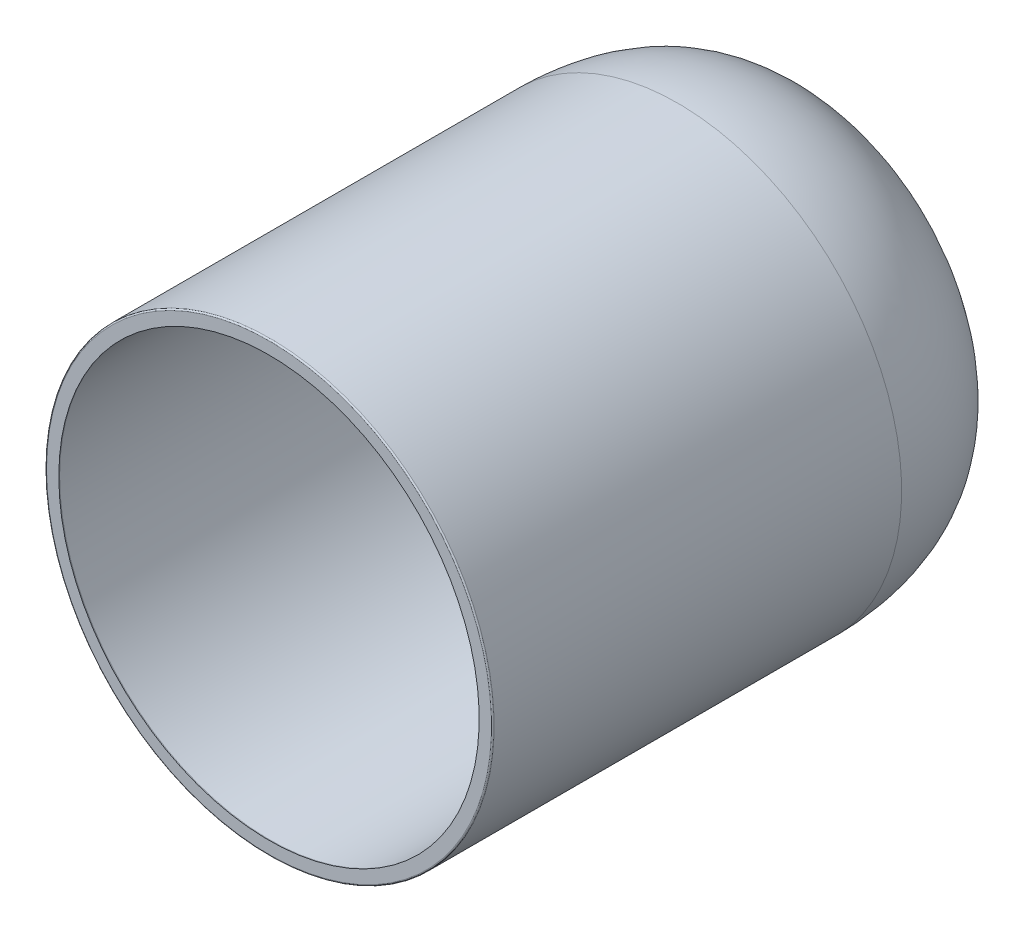
from build123d import *

# Parameters (mm, degrees)
REVOLVE_THIN3_OUTLINE_W   = 2.54
REVOLVE_THIN3_OUTLINE_H   = 76.976451611
REVOLVE_THIN3_OUTLINE_H_2 = 0.206366599
REVOLVE_THIN3_OUTLINE_H_3 = 0.02094686
SKETCH32_R                = 47.246273806
SKETCH32_R_2              = 1.041920848
BOSS_EXTRUDE1_DEPTH       = 2.54
FILLET1_R                 = 2.54
SKETCH33_W                = 85.158841119
SKETCH33_H                = 0.170915888
CUT_EXTRUDE1_DEPTH        = 108.458
FILLET2_R                 = 0.254
FILLET3_R                 = 0.254
SCALE3_SCALE              = 1.65
SKETCH35_W                = 53.780187303
SKETCH35_H                = 190.112658653
CUT_EXTRUDE2_DEPTH        = 201.422


# Read off the part's stored shape, not the designer's step: Revolve-Thin3
with BuildPart() as part:
    # Revolve-Thin3 outline → Revolve-Thin3 (revolve)
    with BuildSketch(Plane.XZ.offset(-16.473592108)):
        with Locations((40.968314643, -5.968874658)):
            Rectangle(REVOLVE_THIN3_OUTLINE_W, REVOLVE_THIN3_OUTLINE_H)
        with BuildLine():
            add(Edge.make_bspline(
                [(39.698314643, 32.519351147), (39.687726817, 32.588202211), (39.677799336, 32.656993484), (39.668523832, 32.725717746)],
                knots=[0, 0, 0, 0, 0.007277117, 0.007277117, 0.007277117, 0.007277117], degree=3))
            Line((39.698314643, 32.519351147), (39.698314643, 32.725717746))
            Line((39.698314643, 32.725717746), (39.668523832, 32.725717746))
        make_face()
        with Locations((40.968314643, 32.622534446)):
            Rectangle(REVOLVE_THIN3_OUTLINE_W, REVOLVE_THIN3_OUTLINE_H_2)
        with BuildLine():
            add(Edge.make_bspline(
                [(39.668523832, 32.725717746), (39.518472779, 33.837479263), (39.539043978, 34.931703978), (39.695973098, 35.985611225), (39.697140195, 35.99339708), (39.698314643, 36.001180261)],
                knots=[0.007277117, 0.007277117, 0.007277117, 0.007277117, 0.125, 0.125, 0.125876466, 0.125876466, 0.125876466, 0.125876466], degree=3))
            Line((39.668523832, 32.725717746), (39.698314643, 32.725717746))
            Line((39.698314643, 32.725717746), (39.698314643, 36.001180261))
        make_face()
        with BuildLine():
            Line((39.698314643, -44.478047324), (39.698314643, -44.457100464))
            add(Edge.make_bspline(
                [(39.697961573, -44.478047324), (39.698080508, -44.471066539), (39.698198198, -44.464084253), (39.698314643, -44.457100464)],
                knots=[0.999591782, 0.999591782, 0.999591782, 0.999591782, 1, 1, 1, 1], degree=3))
            Line((39.697961573, -44.478047324), (39.698314643, -44.478047324))
        make_face()
        with Locations((40.968314643, -44.467573894)):
            Rectangle(REVOLVE_THIN3_OUTLINE_W, REVOLVE_THIN3_OUTLINE_H_3)
        with BuildLine():
            Line((39.698314643, 36.001180261), (39.698314643, 32.725717746))
            Line((39.698314643, 32.725717746), (42.238314643, 32.725717746))
            add(Edge.make_bspline(
                [(42.238314643, 32.725717746), (42.054562539, 33.777592883), (42.068967464, 34.803136992), (42.238314643, 35.799403945)],
                knots=[0, 0, 0, 0, 0.141281123, 0.141281123, 0.141281123, 0.141281123], degree=3))
            Line((42.238314643, 35.799403945), (42.238314643, 42.203297665))
            add(Edge.make_bspline(
                [(39.698314643, 36.001180261), (39.864637797, 37.10341997), (40.178381679, 38.152034474), (41.000947274, 40.135916369), (41.510862605, 41.071843995), (42.130351801, 42.038577334), (42.184085036, 42.121152876), (42.238314643, 42.203297665)],
                knots=[0.125876466, 0.125876466, 0.125876466, 0.125876466, 0.25, 0.25, 0.375, 0.375, 0.386733849, 0.386733849, 0.386733849, 0.386733849], degree=3))
        make_face()
        with BuildLine():
            Line((39.698314643, -44.478047324), (39.697961573, -44.478047324))
            add(Edge.make_bspline(
                [(18.010435206, -70.677083721), (19.79573085, -70.522158772), (21.456515081, -70.25595625), (24.590707244, -69.498066317), (26.054293619, -68.998406284), (28.729976787, -67.78317439), (29.942341958, -67.068017905), (32.141805888, -65.420707287), (33.129574164, -64.488411909), (34.902639951, -62.386085615), (35.688102783, -61.215394241), (37.05999238, -58.60954034), (37.646016791, -57.174096931), (39.087083849, -52.452836699), (39.625242566, -48.746219412), (39.697961573, -44.478047324)],
                knots=[0.004627238, 0.004627238, 0.004627238, 0.004627238, 0.125, 0.125, 0.25, 0.25, 0.375, 0.375, 0.5, 0.5, 0.625, 0.625, 0.75, 0.75, 0.999591782, 0.999591782, 0.999591782, 0.999591782], degree=3))
            Line((18.010435206, -70.677083721), (18.010435206, -70.694456457))
            Line((18.010435206, -70.694456457), (28.462249201, -70.694456457))
            add(Edge.make_bspline(
                [(28.462249201, -70.694456457), (36.319875776, -67.117155429), (39.698314643, -58.770046926)],
                knots=[0.250450742, 0.250450742, 0.250450742, 0.688405646, 0.688405646, 0.688405646], degree=2))
            Line((39.698314643, -58.770046926), (39.698314643, -44.478047324))
        make_face()
        with BuildLine():
            Line((42.238314643, -44.478047324), (39.698314643, -44.478047324))
            Line((39.698314643, -44.478047324), (39.698314643, -58.770046926))
            add(Edge.make_bspline(
                [(39.698314643, -58.770046926), (42.101992439, -52.831280485), (42.238314643, -44.478047324)],
                knots=[0.688405646, 0.688405646, 0.688405646, 1, 1, 1], degree=2))
        make_face()
        with BuildLine():
            add(Edge.make_bspline(
                [(42.238314643, 42.203297665), (42.472937439, 42.558694673), (42.716851503, 42.906028704), (43.268191066, 43.654706519), (43.576088068, 44.050007388), (44.486136773, 45.194626874), (45.074219946, 45.904218472), (46.0952688, 47.247624232), (46.526137449, 47.880446647), (46.995778794, 48.764796386), (47.123505223, 49.048386117), (47.278542653, 49.476995244), (47.325447008, 49.628350247), (47.363757964, 49.77823029)],
                knots=[0.386733849, 0.386733849, 0.386733849, 0.386733849, 0.4375, 0.4375, 0.5, 0.5, 0.625, 0.625, 0.75, 0.75, 0.8125, 0.8125, 0.847702352, 0.847702352, 0.847702352, 0.847702352], degree=3))
            Line((42.238314643, 42.203297665), (42.238314643, 35.799403945))
            add(Edge.make_bspline(
                [(42.238314643, 35.799403945), (42.577155463, 37.792799485), (44.167905472, 40.904465888), (46.512712316, 43.628815223), (47.363757964, 44.722836867)],
                knots=[0.141281123, 0.141281123, 0.141281123, 0.141281123, 0.423965559, 0.610115154, 0.610115154, 0.610115154, 0.610115154], degree=3))
            Line((47.363757964, 44.722836867), (47.363757964, 49.77823029))
        make_face()
        with BuildLine():
            Line((18.010435206, -70.694456457), (18.010435206, -70.677083721))
            add(Edge.make_bspline(
                [(17.803998036, -70.694456457), (17.872994465, -70.688830195), (17.941806831, -70.683039176), (18.010435206, -70.677083721)],
                knots=[0, 0, 0, 0, 0.004627238, 0.004627238, 0.004627238, 0.004627238], degree=3))
            Line((17.803998036, -70.694456457), (18.010435206, -70.694456457))
        make_face()
        with BuildLine():
            add(Edge.make_bspline(
                [(47.363757964, 49.77823029), (47.393466178, 49.894454702), (47.418006992, 50.009792187), (47.482293388, 50.388738185), (47.501353806, 50.652055315), (47.481910982, 51.210629928), (47.44332582, 51.506604575), (47.363757964, 51.83451188)],
                knots=[0.847702352, 0.847702352, 0.847702352, 0.847702352, 0.875, 0.875, 0.9375, 0.9375, 1, 1, 1, 1], degree=3))
            Line((47.363757964, 49.77823029), (47.363757964, 44.722836867))
            add(Edge.make_bspline(
                [(47.363757964, 44.722836867), (48.462338755, 46.135065654), (49.427688757, 47.567830661), (49.832127601, 49.178979157)],
                knots=[0.610115154, 0.610115154, 0.610115154, 0.610115154, 0.850408223, 0.850408223, 0.850408223, 0.850408223], degree=3))
            Line((49.832127601, 49.178979157), (49.832127601, 51.83451188))
            Line((49.832127601, 51.83451188), (47.363757964, 51.83451188))
        make_face()
        Polygon((18.010435206, -70.694456457), (17.803998036, -70.694456457), (18.010435206, -73.226053521), align=None)
        with BuildLine():
            Line((28.462249201, -70.694456457), (18.010435206, -70.694456457))
            Line((18.010435206, -70.694456457), (18.010435206, -73.226053521))
            add(Edge.make_bspline(
                [(18.010435206, -73.226053521), (23.968753656, -72.740186943), (28.462249201, -70.694456457)],
                knots=[0, 0, 0, 0.250450742, 0.250450742, 0.250450742], degree=2))
        make_face()
        Polygon((49.832127601, 52.433470423), (47.363757964, 51.83451188), (49.832127601, 51.83451188), align=None)
        with BuildLine():
            Line((49.832127601, 51.83451188), (49.832127601, 49.178979157))
            add(Edge.make_bspline(
                [(49.832127601, 49.178979157), (49.962029278, 49.696463804), (50.0340657, 50.232351019), (50.034065718, 50.791871057)],
                knots=[0.850408223, 0.850408223, 0.850408223, 0.850408223, 0.927587932, 0.927587932, 0.927587932, 0.927587932], degree=3))
            add(Edge.make_bspline(
                [(50.034065718, 50.791871057), (50.034065729, 51.130381669), (50.007698462, 51.477542535), (49.951825757, 51.83451188)],
                knots=[0.927587932, 0.927587932, 0.927587932, 0.927587932, 0.974281793, 0.974281793, 0.974281793, 0.974281793], degree=3))
            Line((49.951825757, 51.83451188), (49.832127601, 51.83451188))
        make_face()
        with BuildLine():
            add(Edge.make_bspline(
                [(49.951825757, 51.83451188), (49.921051995, 52.031124695), (49.881327391, 52.230713035), (49.832127601, 52.433470423)],
                knots=[0.974281793, 0.974281793, 0.974281793, 0.974281793, 1, 1, 1, 1], degree=3))
            Line((49.832127601, 52.433470423), (49.832127601, 51.83451188))
            Line((49.832127601, 51.83451188), (49.951825757, 51.83451188))
        make_face()
    revolve(axis=Axis((0, 16.473592108, 0), (0, 0, 1)))

    # Sketch33 → Cut-Extrude1 (cut)
    with BuildSketch(Plane(origin=(0, 76.2, 0), x_dir=(1, 0, 0), z_dir=(0, 1, 0))):
        with Locations((-0.060456445, -32.78023641)):
            Rectangle(SKETCH33_W, SKETCH33_H)
    extrude(amount=-CUT_EXTRUDE1_DEPTH, mode=Mode.SUBTRACT)


with BuildPart() as body_2:
    # Sketch32 → Boss-Extrude1 (new body)
    with BuildSketch(Plane.XY.offset(52.433470423)):
        with Locations((0, 16.473592108)):
            Circle(SKETCH32_R)
        with Locations((0, 16.473592108)):
            Circle(SKETCH32_R_2, mode=Mode.SUBTRACT)
    extrude(amount=BOSS_EXTRUDE1_DEPTH)

    # Fillet1
    fillet1_edges = [body_2.edges().sort_by_distance(p)[0] for p in [
        (-47.246273806, 16.473592108, 54.973470423),
        (-1.041920848, 16.473592108, 54.973470423),
    ]]
    fillet(fillet1_edges, radius=FILLET1_R - 0.0001)  # a hair under: the kernel refuses the full size


with BuildPart() as cut_extrude1_piece_1:
    # of the separate pieces the step leaves, piece 1, a body of its own (cut_extrude1_pieces)
    add(part.part.solids().sort_by_distance((42.238314643, 16.473592108, 32.694778466))[0])

    # Fillet2
    fillet2_edges = [cut_extrude1_piece_1.edges().sort_by_distance(p)[0] for p in [
        (-42.238314643, 16.473592108, 32.694778466),
    ]]
    fillet(fillet2_edges, radius=FILLET2_R)


with BuildPart() as cut_extrude1_piece_2:
    # of the separate pieces the step leaves, piece 2, a body of its own (cut_extrude1_pieces)
    add(part.part.solids().sort_by_distance((42.215003382, 16.473592108, 32.865694354))[0])

    # Fillet3
    fillet3_edges = [cut_extrude1_piece_2.edges().sort_by_distance(p)[0] for p in [
        (-42.21500338, 16.473592107, 32.865694354),
    ]]
    fillet(fillet3_edges, radius=FILLET3_R)


with BuildPart() as body_2_1:
    # Scale3: scaled about (0, 0, 0)
    add(body_2.part.scale(SCALE3_SCALE))


with BuildPart() as cut_extrude1_piece_1_1:
    # Scale3: scaled about (0, 0, 0)
    add(cut_extrude1_piece_1.part.scale(SCALE3_SCALE))


with BuildPart() as cut_extrude1_piece_2_1:
    # Scale3: scaled about (0, 0, 0)
    add(cut_extrude1_piece_2.part.scale(SCALE3_SCALE))


with BuildPart() as cut_extrude2_tool:
    # Sketch35 → Cut-Extrude2 (new body)
    with BuildSketch(Plane(origin=(-101.6, 0, 0), x_dir=(0, 0, -1), z_dir=(1, 0, 0))):
        with Locations((-80.974469867, 30.532269515)):
            Rectangle(SKETCH35_W, SKETCH35_H)
    extrude(amount=CUT_EXTRUDE2_DEPTH)


with BuildPart() as body_2_2:
    add(body_2_1.part)

    # Cut-Extrude2: cut by cut_extrude2_tool
    add(cut_extrude2_tool.part, mode=Mode.SUBTRACT)


with BuildPart() as cut_extrude1_piece_2_2:
    add(cut_extrude1_piece_2_1.part)

    # Cut-Extrude2: cut by cut_extrude2_tool
    add(cut_extrude2_tool.part, mode=Mode.SUBTRACT)


solid = cut_extrude1_piece_1_1.part
